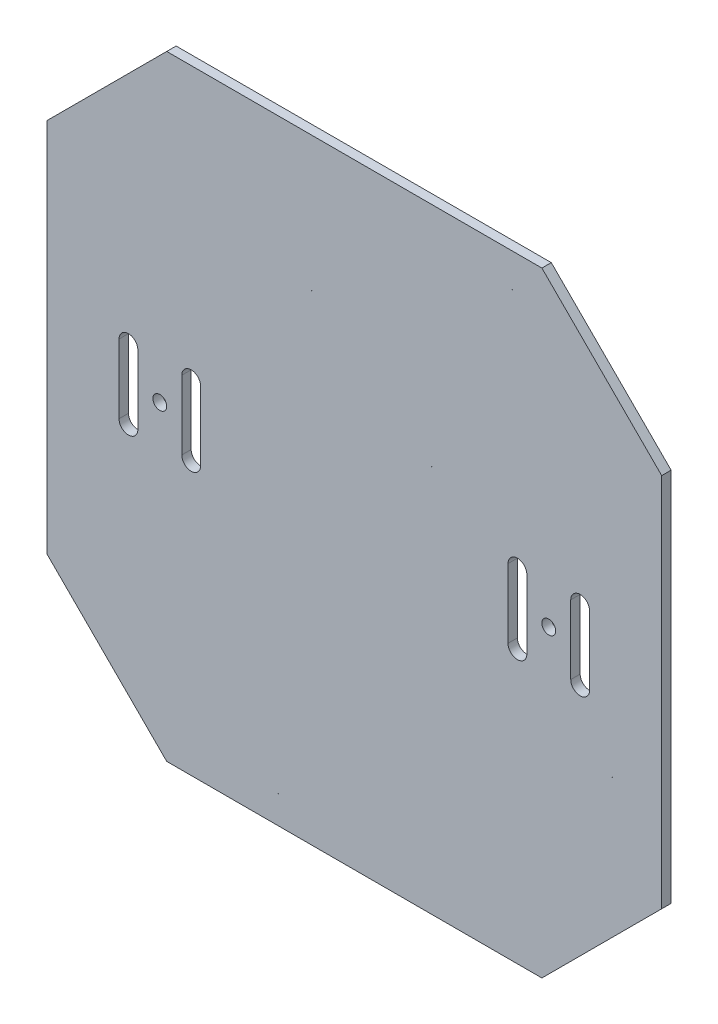
from build123d import *

# Parameters (mm, degrees)
BOSS_EXTRUDE1_OUTLINE_R  = 1.1
BOSS_EXTRUDE1_DEPTH      = 1.5
BOSS_EXTRUDE2_DEPTH      = 1.5
BOSS_EXTRUDE2_DEPTH_BACK = 0.5


# Read off the part's stored shape, not the designer's step: Boss-Extrude1
with BuildPart() as part:
    # Boss-Extrude1 outline → Boss-Extrude1 (new body)
    with BuildSketch(Plane.XY):
        Polygon((19.1, 98), (0, 78.9), (0, 19.1), (19.1, 0), (78.9, 0), (98, 19.1), (98, 78.9), (78.9, 98), align=None)
        with BuildLine():
            Line((36.8757, 35.879), (36.857308756, 4.446264405))
            ThreePointArc((36.857308756, 4.446264405), (36.875994273, 4.43215571), (36.879898885, 4.409069831))
            ThreePointArc((36.879898885, 4.409069831), (36.853148575, 4.399873011), (36.829703907, 4.41570046))
            Line((36.829703907, 4.41570046), (24.3261, 4.416))
            Line((24.3261, 4.416), (34.2414, 33.6881))
            Line((34.2414, 33.6881), (36.8757, 35.879))
        make_face(mode=Mode.SUBTRACT)
        with BuildLine():
            Line((20.5443, 6.661), (20.562691244, 38.093735595))
            ThreePointArc((20.562691244, 38.093735595), (20.544005727, 38.10784429), (20.540101115, 38.130930169))
            ThreePointArc((20.540101115, 38.130930169), (20.566851425, 38.140126989), (20.590296093, 38.12429954))
            Line((20.590296093, 38.12429954), (33.0939, 38.124))
            Line((33.0939, 38.124), (23.1786, 8.8519))
            Line((23.1786, 8.8519), (20.5443, 6.661))
        make_face(mode=Mode.SUBTRACT)
        with BuildLine():
            Line((11.5, 43.5), (11.5, 54.5))
            ThreePointArc((11.5, 54.5), (13, 56), (14.5, 54.5))
            Line((14.5, 54.5), (14.5, 43.5))
            ThreePointArc((14.5, 43.5), (13, 42), (11.5, 43.5))
        make_face(mode=Mode.SUBTRACT)
        with Locations((18, 49)):
            Circle(BOSS_EXTRUDE1_OUTLINE_R, mode=Mode.SUBTRACT)
        with BuildLine():
            Line((21.5, 43.5), (21.5, 54.5))
            ThreePointArc((21.5, 54.5), (23, 56), (24.5, 54.5))
            Line((24.5, 54.5), (24.5, 43.5))
            ThreePointArc((24.5, 43.5), (23, 42), (21.5, 43.5))
        make_face(mode=Mode.SUBTRACT)
        with BuildLine():
            Line((83.379, 5.9243), (51.946264405, 5.942691244))
            ThreePointArc((51.946264405, 5.942691244), (51.93215571, 5.924005727), (51.909069831, 5.920101115))
            ThreePointArc((51.909069831, 5.920101115), (51.899873011, 5.946851425), (51.91570046, 5.970296093))
            Line((51.91570046, 5.970296093), (51.916, 18.4739))
            Line((51.916, 18.4739), (81.1881, 8.5586))
            Line((81.1881, 8.5586), (83.379, 5.9243))
        make_face(mode=Mode.SUBTRACT)
        with BuildLine():
            Line((58.661, 33.3357), (90.093735595, 33.317308756))
            ThreePointArc((90.093735595, 33.317308756), (90.10784429, 33.335994273), (90.130930169, 33.339898885))
            ThreePointArc((90.130930169, 33.339898885), (90.140126989, 33.313148575), (90.12429954, 33.289703907))
            Line((90.12429954, 33.289703907), (90.124, 20.7861))
            Line((90.124, 20.7861), (60.8519, 30.7014))
            Line((60.8519, 30.7014), (58.661, 33.3357))
        make_face(mode=Mode.SUBTRACT)
        with BuildLine():
            Line((73.5, 43.5), (73.5, 54.5))
            ThreePointArc((73.5, 54.5), (75, 56), (76.5, 54.5))
            Line((76.5, 54.5), (76.5, 43.5))
            ThreePointArc((76.5, 43.5), (75, 42), (73.5, 43.5))
        make_face(mode=Mode.SUBTRACT)
        with Locations((80, 49)):
            Circle(BOSS_EXTRUDE1_OUTLINE_R, mode=Mode.SUBTRACT)
        with BuildLine():
            Line((83.5, 43.5), (83.5, 54.5))
            ThreePointArc((83.5, 54.5), (85, 56), (86.5, 54.5))
            Line((86.5, 54.5), (86.5, 43.5))
            ThreePointArc((86.5, 43.5), (85, 42), (83.5, 43.5))
        make_face(mode=Mode.SUBTRACT)
        with BuildLine():
            Line((35.009, 62.2543), (3.576264405, 62.272691244))
            ThreePointArc((3.576264405, 62.272691244), (3.56215571, 62.254005727), (3.539069831, 62.250101115))
            ThreePointArc((3.539069831, 62.250101115), (3.529873011, 62.276851425), (3.54570046, 62.300296093))
            Line((3.54570046, 62.300296093), (3.546, 74.8039))
            Line((3.546, 74.8039), (32.8181, 64.8886))
            Line((32.8181, 64.8886), (35.009, 62.2543))
        make_face(mode=Mode.SUBTRACT)
        with BuildLine():
            Line((10.751, 76.5657), (42.183735595, 76.547308756))
            ThreePointArc((42.183735595, 76.547308756), (42.19784429, 76.565994273), (42.220930169, 76.569898885))
            ThreePointArc((42.220930169, 76.569898885), (42.230126989, 76.543148575), (42.21429954, 76.519703907))
            Line((42.21429954, 76.519703907), (42.214, 64.0161))
            Line((42.214, 64.0161), (12.9419, 73.9314))
            Line((12.9419, 73.9314), (10.751, 76.5657))
        make_face(mode=Mode.SUBTRACT)
        with BuildLine():
            Line((53.599, 81.6043), (22.166264405, 81.622691244))
            ThreePointArc((22.166264405, 81.622691244), (22.15215571, 81.604005727), (22.129069831, 81.600101115))
            ThreePointArc((22.129069831, 81.600101115), (22.119873011, 81.626851425), (22.13570046, 81.650296093))
            Line((22.13570046, 81.650296093), (22.136, 94.1539))
            Line((22.136, 94.1539), (51.4081, 84.2386))
            Line((51.4081, 84.2386), (53.599, 81.6043))
        make_face(mode=Mode.SUBTRACT)
        with BuildLine():
            Line((92.809, 61.7843), (61.376264405, 61.802691244))
            ThreePointArc((61.376264405, 61.802691244), (61.36215571, 61.784005727), (61.339069831, 61.780101115))
            ThreePointArc((61.339069831, 61.780101115), (61.329873011, 61.806851425), (61.34570046, 61.830296093))
            Line((61.34570046, 61.830296093), (61.346, 74.3339))
            Line((61.346, 74.3339), (90.6181, 64.4186))
            Line((90.6181, 64.4186), (92.809, 61.7843))
        make_face(mode=Mode.SUBTRACT)
        with BuildLine():
            Line((63.531, 77.7357), (94.963735595, 77.717308756))
            ThreePointArc((94.963735595, 77.717308756), (94.97784429, 77.735994273), (95.000930169, 77.739898885))
            ThreePointArc((95.000930169, 77.739898885), (95.010126989, 77.713148575), (94.99429954, 77.689703907))
            Line((94.99429954, 77.689703907), (94.994, 65.1861))
            Line((94.994, 65.1861), (65.7219, 75.1014))
            Line((65.7219, 75.1014), (63.531, 77.7357))
        make_face(mode=Mode.SUBTRACT)
        with BuildLine():
            Line((42.721, 92.6557), (74.153735595, 92.637308756))
            ThreePointArc((74.153735595, 92.637308756), (74.16784429, 92.655994273), (74.190930169, 92.659898885))
            ThreePointArc((74.190930169, 92.659898885), (74.200126989, 92.633148575), (74.18429954, 92.609703907))
            Line((74.18429954, 92.609703907), (74.184, 80.1061))
            Line((74.184, 80.1061), (44.9119, 90.0214))
            Line((44.9119, 90.0214), (42.721, 92.6557))
        make_face(mode=Mode.SUBTRACT)
    extrude(amount=BOSS_EXTRUDE1_DEPTH)

    # Model<4> → Boss-Extrude2 (add, two sides: drawn at the far end of the back side and taken through both)
    with BuildSketch(Plane.XY.offset(-BOSS_EXTRUDE2_DEPTH_BACK)):
        Polygon((42.2143, 76.5473), (42.1987, 76.5473), (42.183735595, 76.547308756), (10.751, 76.5657), (12.92157794, 73.955834891), (12.9419, 73.9314), (12.971962529, 73.921216959), (42.214, 64.0161), (42.21429954, 76.519703907), (42.2143, 76.5389), align=None)
        Polygon((3.54570046, 62.300296093), (3.5457, 62.2811), (3.5457, 62.2727), (3.5613, 62.2727), (3.576264405, 62.272691244), (35.009, 62.2543), (32.83842206, 64.864165109), (32.8181, 64.8886), (32.788037471, 64.898783041), (3.546, 74.8039), align=None)
        Polygon((22.13570046, 81.650296093), (22.1357, 81.6311), (22.1357, 81.623120089), (22.1513, 81.6227), (22.166264405, 81.622691244), (53.599, 81.6043), (51.42842206, 84.214165109), (51.4081, 84.2386), (51.378037471, 84.248783041), (22.136, 94.1539), align=None)
        Polygon((74.1843, 92.6373), (74.1687, 92.6373), (74.153735595, 92.637308756), (42.721, 92.6557), (44.89157794, 90.045834891), (44.9119, 90.0214), (44.941962529, 90.011216959), (74.184, 80.1061), (74.18429954, 92.609703907), (74.1843, 92.6289), align=None)
        Polygon((94.9943, 77.7173), (94.9787, 77.7173), (94.963735595, 77.717308756), (63.531, 77.7357), (65.70157794, 75.125834891), (65.7219, 75.1014), (65.751962529, 75.091216959), (94.994, 65.1861), (94.99429954, 77.689703907), (94.9943, 77.7089), align=None)
        Polygon((61.34570046, 61.830296093), (61.3457, 61.8111), (61.3457, 61.8027), (61.3613, 61.8027), (61.376264405, 61.802691244), (92.809, 61.7843), (90.63842206, 64.394165109), (90.6181, 64.4186), (90.588037471, 64.428783041), (61.346, 74.3339), align=None)
        Polygon((20.5627, 38.1243), (20.5627, 38.1087), (20.562691244, 38.093735595), (20.5443, 6.661), (23.154165109, 8.83157794), (23.1786, 8.8519), (23.188783041, 8.881962529), (33.0939, 38.124), (20.590296093, 38.12429954), (20.5711, 38.1243), align=None)
        Polygon((36.8573, 4.4157), (36.8573, 4.4313), (36.857308756, 4.446264405), (36.8757, 35.879), (34.265834891, 33.70842206), (34.2414, 33.6881), (34.231216959, 33.658037471), (24.3261, 4.416), (36.829703907, 4.41570046), (36.8489, 4.4157), align=None)
        Polygon((51.91570046, 5.970296093), (51.9157, 5.9511), (51.9157, 5.9427), (51.9313, 5.9427), (51.946264405, 5.942691244), (83.379, 5.9243), (81.20842206, 8.534165109), (81.1881, 8.5586), (81.158037471, 8.568783041), (51.916, 18.4739), align=None)
        Polygon((90.1243, 33.3173), (90.1087, 33.3173), (90.093735595, 33.317308756), (58.661, 33.3357), (60.83157794, 30.725834891), (60.8519, 30.7014), (60.881962529, 30.691216959), (90.124, 20.7861), (90.12429954, 33.289703907), (90.1243, 33.3089), align=None)
    extrude(amount=BOSS_EXTRUDE2_DEPTH + BOSS_EXTRUDE2_DEPTH_BACK)


solid = part.part
